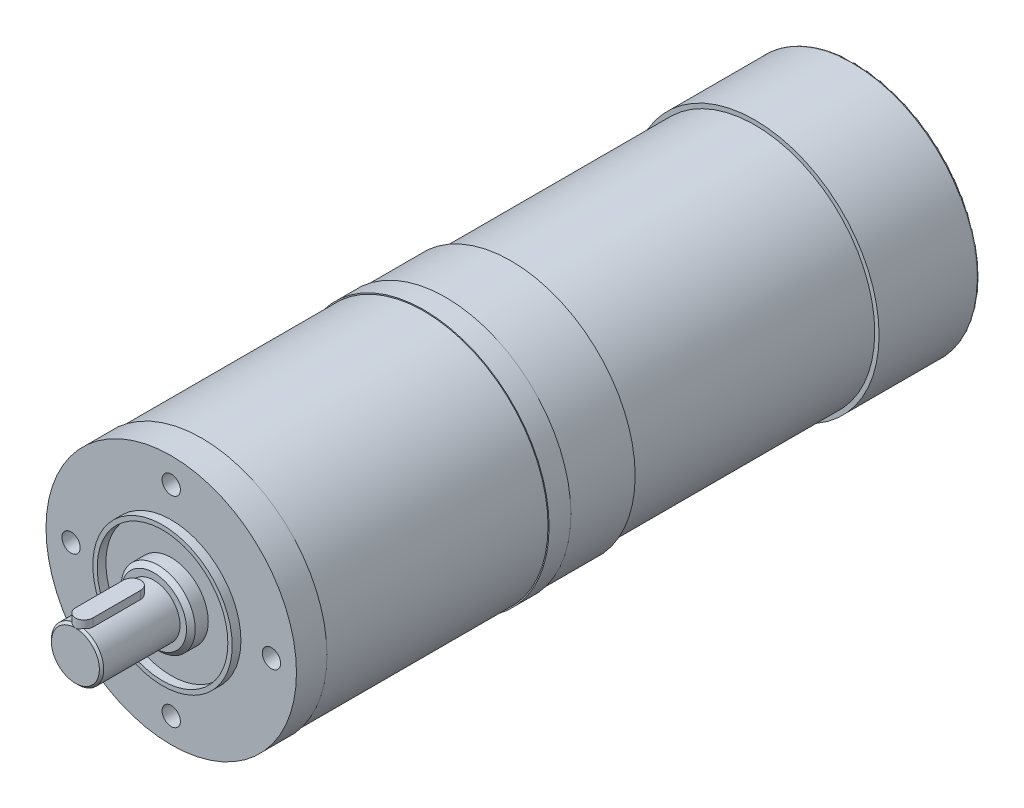
from build123d import *

# Parameters (mm, degrees)
ESQUISSE1_R                  = 28.5
BOSS_EXTRU_1_DEPTH           = 23
ESQUISSE3_R                  = 27.5
BOSS_EXTRU_2_DEPTH           = 56
ESQUISSE4_R                  = 28.5
BOSS_EXTRU_3_DEPTH           = 15
ESQUISSE5_R                  = 28.75
BOSS_EXTRU_4_DEPTH           = 5
ESQUISSE6_R                  = 28.5
BOSS_EXTRU_5_DEPTH           = 51
ESQUISSE7_R                  = 28.75
BOSS_EXTRU_6_DEPTH           = 7
CONG_1_R                     = 0.5
ESQUISSE8_R                  = 16
ESQUISSE8_R_2                = 15
BOSS_EXTRU_7_DEPTH           = 2
ESQUISSE9_R                  = 8.5
BOSS_EXTRU_8_DEPTH           = 4
CHANFREIN1_SIZE              = 1
ESQUISSE10_R                 = 6
BOSS_EXTRU_9_DEPTH           = 18
CHANFREIN2_SIZE              = 0.5
BOSS_EXTRU_10_DEPTH          = 1.5
BOSS_EXTRU_10_DEPTH_BACK     = 1
R_P_TITION_CIRCULAIRE1_COUNT = 4


with BuildPart() as part:
    # Esquisse1 → Boss.-Extru.1 (new body)
    with BuildSketch(Plane.XY):
        Circle(ESQUISSE1_R)
    extrude(amount=BOSS_EXTRU_1_DEPTH)

    # Esquisse3 → Boss.-Extru.2 (add)
    with BuildSketch(Plane.XY.offset(23)):
        Circle(ESQUISSE3_R)
    extrude(amount=BOSS_EXTRU_2_DEPTH)

    # Esquisse4 → Boss.-Extru.3 (add)
    with BuildSketch(Plane.XY.offset(79)):
        Circle(ESQUISSE4_R)
    extrude(amount=BOSS_EXTRU_3_DEPTH)

    # Esquisse5 → Boss.-Extru.4 (add)
    with BuildSketch(Plane.XY.offset(94)):
        Circle(ESQUISSE5_R)
    extrude(amount=BOSS_EXTRU_4_DEPTH)

    # Esquisse6 → Boss.-Extru.5 (add)
    with BuildSketch(Plane.XY.offset(99)):
        Circle(ESQUISSE6_R)
    extrude(amount=BOSS_EXTRU_5_DEPTH)

    # Esquisse7 → Boss.-Extru.6 (add)
    with BuildSketch(Plane.XY.offset(150)):
        Circle(ESQUISSE7_R)
    extrude(amount=BOSS_EXTRU_6_DEPTH)

    # Congé1
    cong_1_edges = [part.edges().sort_by_distance(p)[0] for p in [
        (-28.5, 0, 0),
    ]]
    fillet(cong_1_edges, radius=CONG_1_R)

    # Esquisse8 → Boss.-Extru.7 (add)
    with BuildSketch(Plane.XY.offset(157)):
        Circle(ESQUISSE8_R)
        Circle(ESQUISSE8_R_2, mode=Mode.SUBTRACT)
    extrude(amount=BOSS_EXTRU_7_DEPTH)

    # Esquisse9 → Boss.-Extru.8 (add)
    with BuildSketch(Plane.XY.offset(157)):
        Circle(ESQUISSE9_R)
    extrude(amount=BOSS_EXTRU_8_DEPTH)

    # Chanfrein1
    chanfrein1_edges = [part.edges().sort_by_distance(p)[0] for p in [
        (-8.5, 0, 161),
    ]]
    chamfer(chanfrein1_edges, length=CHANFREIN1_SIZE)

    # Esquisse10 → Boss.-Extru.9 (add)
    with BuildSketch(Plane.XY.offset(161)):
        Circle(ESQUISSE10_R)
    extrude(amount=BOSS_EXTRU_9_DEPTH)

    # Chanfrein2
    chanfrein2_edges = [part.edges().sort_by_distance(p)[0] for p in [
        (-6, 0, 179),
    ]]
    chamfer(chanfrein2_edges, length=CHANFREIN2_SIZE)

    # Esquisse11 → Boss.-Extru.10 (add, two sides: drawn at the far end of the back side and taken through both)
    with BuildSketch(Plane(origin=(0, 6, 0), x_dir=(1, 0, 0), z_dir=(0, 1, 0)).offset(-BOSS_EXTRU_10_DEPTH_BACK)):
        with BuildLine():
            Line((-2, -177), (-2, -166))
            ThreePointArc((-2, -166), (0, -164), (2, -166))
            Line((2, -166), (2, -177))
            ThreePointArc((2, -177), (0, -179), (-2, -177))
        make_face()
    extrude(amount=BOSS_EXTRU_10_DEPTH + BOSS_EXTRU_10_DEPTH_BACK)

    # Esquisse12 → Trou pour taraudage pour trou taraudé M51 (revolve, cut)
    with BuildSketch(Plane(origin=(-23, 0, 157), x_dir=(0, -1, 0), z_dir=(1, 0, 0))):
        Polygon((0, 0), (0, 8.2618073), (2.1, 7), (2.1, 0), align=None)
    trou_pour_taraudage_pour_trou_taraud_m5 = revolve(axis=Axis((-23, 0, 163.35), (0, 0, -1)), mode=Mode.SUBTRACT)

    # Répétition circulaire1: Trou pour taraudage pour trou taraudé M51 ×4 about axis
    r_p_tition_circulaire1_axis = Axis((0, 0, 178.5), (0, 0, -1))
    for i in range(1, R_P_TITION_CIRCULAIRE1_COUNT):
        add(trou_pour_taraudage_pour_trou_taraud_m5.rotate(r_p_tition_circulaire1_axis, i * 360 / R_P_TITION_CIRCULAIRE1_COUNT), mode=Mode.SUBTRACT)


solid = part.part
